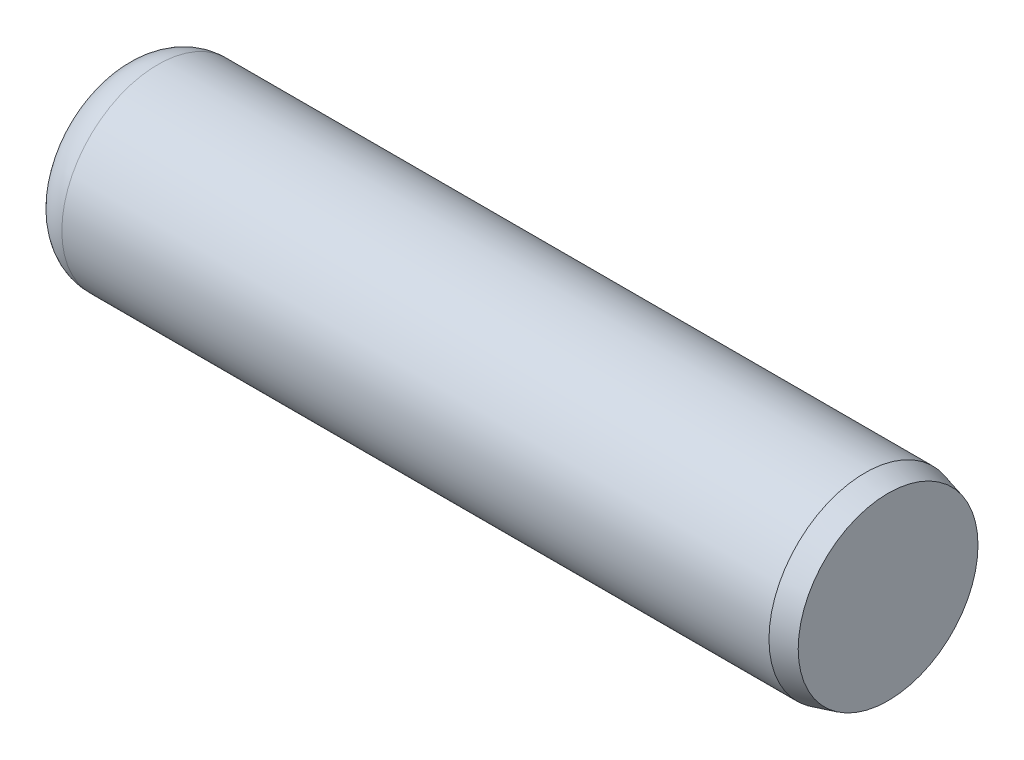
from build123d import *


with BuildPart() as part:
    # Sketch1 → Base-Revolve (revolve)
    with BuildSketch(Plane.XY):
        with BuildLine():
            Line((0, 0), (101.6, 0))
            Line((101.6, 0), (101.6, 11.883290861))
            Line((101.6, 11.883290861), (98.552, 12.7))
            Line((98.552, 12.7), (5.08, 12.7))
            ThreePointArc((5.08, 12.7), (1.487897552, 11.212102448), (0, 7.62))
            Line((0, 7.62), (0, 0))
        make_face()
    revolve(axis=Axis((-6.35, 0, 0), (1, 0, 0)))


solid = part.part
